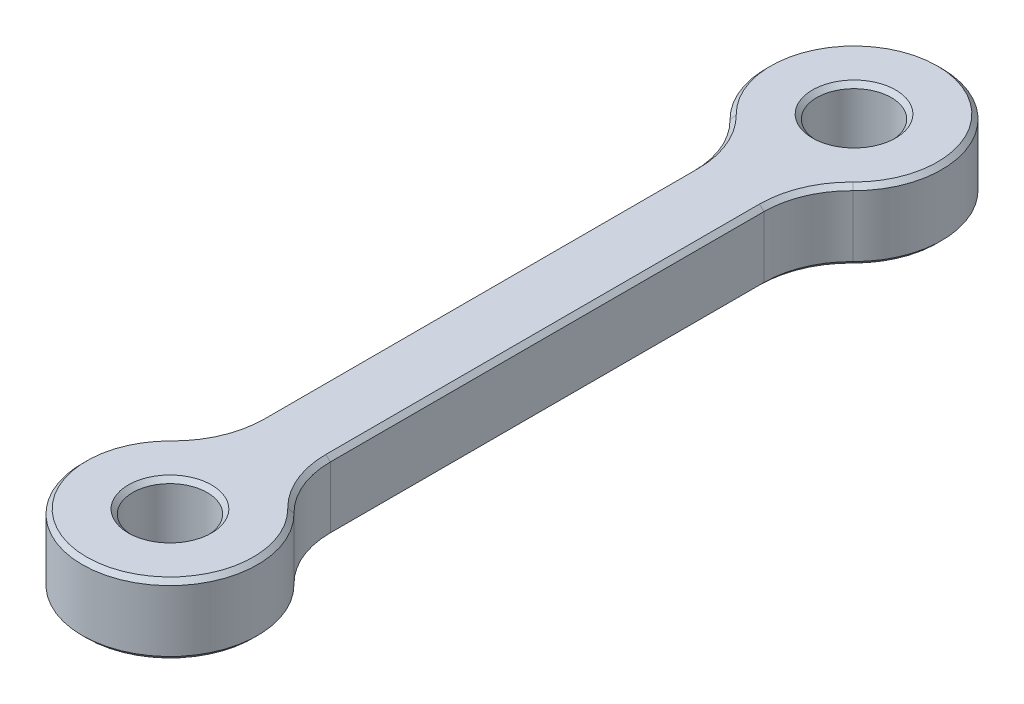
from build123d import *

# Parameters (mm, degrees)
SKETCH1_R           = 4.25
BOSS_EXTRUDE1_DEPTH = 8
FILLET1_R           = 10
CHAMFER1_SIZE       = 0.5


with BuildPart() as part:
    # Sketch1 → Boss-Extrude1 (new body)
    with BuildSketch(Plane(origin=(0, 0, 0), x_dir=(1, 0, 0), z_dir=(0, 1, 0))):
        with BuildLine():
            Line((-4, 29.83484861), (-4, -29.83484861))
            ThreePointArc((-4, -29.83484861), (0, -49), (4, -29.83484861))
            Line((4, -29.83484861), (4, 29.83484861))
            ThreePointArc((4, 29.83484861), (0, 49), (-4, 29.83484861))
        make_face()
        with Locations((0, 39)):
            Circle(SKETCH1_R, mode=Mode.SUBTRACT)
        with Locations((0, -39)):
            Circle(SKETCH1_R, mode=Mode.SUBTRACT)
    extrude(amount=BOSS_EXTRUDE1_DEPTH)

    # Fillet1
    fillet1_edges = [part.edges().sort_by_distance(p)[0] for p in [
        (4, 4, 29.83484861),
        (4, 4, -29.83484861),
        (-4, 4, -29.83484861),
        (-4, 4, 29.83484861),
    ]]
    fillet(fillet1_edges, radius=FILLET1_R)

    # Chamfer1
    chamfer1_edges = [part.edges().sort_by_distance(p)[0] for p in [
        (-4.25, 0, 39),
        (-4.25, 0, -39),
        (-4.780455543, 0, -28.590126489),
        (-4, 0, 0),
        (-4.780455543, 0, 28.590126489),
        (0, 0, 49),
        (4.780455543, 0, 28.590126489),
        (4, 0, 0),
        (4.780455543, 0, -28.590126489),
        (0, 0, -49),
        (-4.25, 8, 39),
        (4.780455543, 8, 28.590126489),
        (0, 8, 49),
        (-4.780455543, 8, 28.590126489),
        (-4, 8, 0),
        (-4.780455543, 8, -28.590126489),
        (0, 8, -49),
        (4.780455543, 8, -28.590126489),
        (4, 8, 0),
        (-4.25, 8, -39),
    ]]
    chamfer(chamfer1_edges, length=CHAMFER1_SIZE)


solid = part.part
